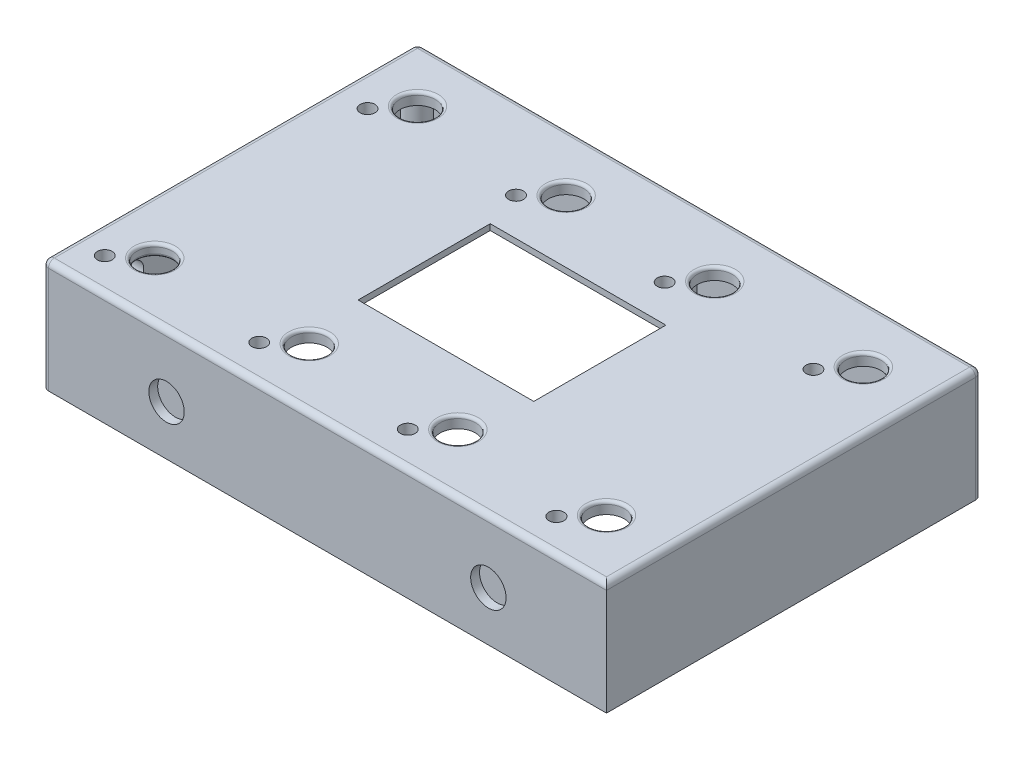
from build123d import *

# Parameters (mm, degrees)
SKETCH11_W                      = 183
SKETCH11_H                      = 119
BOSS_EXTRUDE2_DEPTH             = 34
SHELL19_T                       = 4
BOSS_EXTRUDE4_START             = -34
BOSS_EXTRUDE4_DEPTH             = 34
F_6_32_TAPPED_HOLE1_D           = 2.7051
F_6_32_TAPPED_HOLE1_DEPTH       = 10.97
F_6_32_TAPPED_HOLE1_CSINK_D     = 4.7752
F_6_32_TAPPED_HOLE1_CSINK_ANGLE = 100
F_6_32_TAPPED_HOLE1_TIP         = 0.81269403
FILLET1_R                       = 2
SKETCH15_R                      = 6
CUT_EXTRUDE2_DEPTH              = 153
FILLET2_R                       = 1
SKETCH16_R                      = 6
SKETCH16_W                      = 59.5
SKETCH16_H                      = 44.75
CUT_EXTRUDE3_DEPTH              = 153
FILLET3_R                       = 1
FILLET4_R                       = 1
FILLET5_R                       = 1
FILLET6_R                       = 1
FILLET7_R                       = 1
FILLET8_R                       = 1
FILLET9_R                       = 1
FILLET10_R                      = 1
SKETCH19_R                      = 4
SKETCH19_W                      = 14
SKETCH19_H                      = 8.25
CUT_EXTRUDE4_DEPTH              = 153
SKETCH17_R                      = 6
CUT_EXTRUDE5_DEPTH              = 3
SKETCH22_W                      = 69.6
SKETCH22_H                      = 50.2
CUT_EXTRUDE6_DEPTH              = 2
SKETCH23_R                      = 2.5
SKETCH23_R_2                    = 2.53684151
CUT_EXTRUDE7_DEPTH              = 12


# Read off the part's stored shape, not the designer's step: Boss-Extrude4
with BuildPart() as part:
    # Sketch11 → Boss-Extrude2 (new body)
    with BuildSketch(Plane(origin=(0, 0, 0), x_dir=(1, 0, 0), z_dir=(0, 1, 0))):
        Rectangle(SKETCH11_W, SKETCH11_H)
    extrude(amount=BOSS_EXTRUDE2_DEPTH)

    # Shell19
    shell19_openings = [part.faces().sort_by_distance(p)[0] for p in [
        (0, 0, 0),
    ]]
    offset(amount=SHELL19_T, openings=shell19_openings, kind=Kind.INTERSECTION)

    # Boss-Extrude4 outline → Boss-Extrude4 (add)
    with BuildSketch(Plane(origin=(0, 0, 0), x_dir=(-1, 0, 0), z_dir=(0, -1, 0)).offset(BOSS_EXTRUDE4_START)):
        with BuildLine():
            Line((-91.5, 59.5), (-91.5, 53.791632513))
            ThreePointArc((-91.5, 53.791632513), (-86.395109023, 54.372298689), (-86.072984276, 59.5))
            Line((-86.072984276, 59.5), (-91.5, 59.5))
        make_face()
        with BuildLine():
            ThreePointArc((-86.295538716, -59.5), (-86.27586418, -54.227632818), (-91.5, -53.51584091))
            Line((-91.5, -53.51584091), (-91.5, -59.5))
            Line((-91.5, -59.5), (-86.295538716, -59.5))
        make_face()
        with BuildLine():
            Line((3.221091031, 59.5), (-3.221091031, 59.5))
            ThreePointArc((-3.221091031, 59.5), (0, 53.128381867), (3.221091031, 59.5))
        make_face()
        with BuildLine():
            ThreePointArc((2.998536591, -59.5), (0, -52.852590264), (-2.998536591, -59.5))
            Line((-2.998536591, -59.5), (2.998536591, -59.5))
        make_face()
        with BuildLine():
            Line((91.5, 59.5), (86.08073914, 59.5))
            ThreePointArc((86.08073914, 59.5), (86.399665621, 54.375666676), (91.5, 53.786518703))
            Line((91.5, 53.786518703), (91.5, 59.5))
        make_face()
        with BuildLine():
            ThreePointArc((91.5, -53.5107271), (86.280573114, -54.231139178), (86.30329358, -59.5))
            Line((86.30329358, -59.5), (91.5, -59.5))
            Line((91.5, -59.5), (91.5, -53.5107271))
        make_face()
    extrude(amount=BOSS_EXTRUDE4_DEPTH)

    # #6-32 Tapped Hole1
    with Locations(Plane(origin=(0, 0, 0), x_dir=(-1, 0, 0), z_dir=(0, -1, 0))):
        with Locations((-89.294075307, 57.128381867), (-89.294075307, -56.852590264), (0, -56.852590264), (0, 57.128381867), (89.301830171, 57.128381867), (89.301830171, -56.852590264)):
            CounterSinkHole(F_6_32_TAPPED_HOLE1_D / 2, F_6_32_TAPPED_HOLE1_CSINK_D / 2, depth=F_6_32_TAPPED_HOLE1_DEPTH, counter_sink_angle=F_6_32_TAPPED_HOLE1_CSINK_ANGLE)
            with Locations((0, 0, -(F_6_32_TAPPED_HOLE1_DEPTH + F_6_32_TAPPED_HOLE1_TIP / 2))):  # 118° drill point
                Cone(0, F_6_32_TAPPED_HOLE1_D / 2, F_6_32_TAPPED_HOLE1_TIP, mode=Mode.SUBTRACT)

    # Fillet1
    fillet1_edges = [part.edges().sort_by_distance(p)[0] for p in [
        (-95.5, 38, 0),
        (0, 38, 63.5),
        (95.5, 38, 0),
        (86.295538716, 17, 59.5),
        (-95.5, 19, 63.5),
        (-95.5, 19, -63.5),
        (95.5, 19, -63.5),
        (0, 38, -63.5),
    ]]
    fillet(fillet1_edges, radius=FILLET1_R)

    # Sketch15 → Cut-Extrude2 (cut)
    with BuildSketch(Plane(origin=(0, 0, 0), x_dir=(1, 0, 0), z_dir=(0, 1, 0))):
        with Locations(Location((-76.5, 44.5, 0), (0, 0, 270))):
            Circle(SKETCH15_R)
    extrude(amount=CUT_EXTRUDE2_DEPTH, mode=Mode.SUBTRACT)

    # Fillet2
    fillet2_edges = [part.edges().sort_by_distance(p)[0] for p in [
        (-76.5, 38, -50.5),
    ]]
    fillet(fillet2_edges, radius=FILLET2_R)

    # Sketch16 → Cut-Extrude3 (cut)
    with BuildSketch(Plane(origin=(0, 38, 0), x_dir=(1, 0, 0), z_dir=(0, 1, 0))):
        with Locations(Location((75.5, 43.5, 0), (0, 0, 270))):
            Circle(SKETCH16_R)
        with Locations(Location((-25.166666667, 43.5, 0), (0, 0, 270))):
            Circle(SKETCH16_R)
        with Locations(Location((25.163333333, 43.5, 0), (0, 0, 270))):
            Circle(SKETCH16_R)
        with Locations(Location((-76.5, -44.5, 0), (0, 0, 270))):
            Circle(SKETCH16_R)
        with Locations(Location((75.5, -43.5, 0), (0, 0, 270))):
            Circle(SKETCH16_R)
        with Locations(Location((25.163333333, -43.5, 0), (0, 0, 270))):
            Circle(SKETCH16_R)
        with Locations(Location((-25.166666667, -43.5, 0), (0, 0, 270))):
            Circle(SKETCH16_R)
        Rectangle(SKETCH16_W, SKETCH16_H)
    extrude(amount=-CUT_EXTRUDE3_DEPTH, mode=Mode.SUBTRACT)

    # Fillet3
    fillet3_edges = [part.edges().sort_by_distance(p)[0] for p in [
        (-25.166666667, 38, -49.5),
    ]]
    fillet(fillet3_edges, radius=FILLET3_R)

    # Fillet4
    fillet4_edges = [part.edges().sort_by_distance(p)[0] for p in [
        (25.163333333, 38, -49.5),
    ]]
    fillet(fillet4_edges, radius=FILLET4_R)

    # Fillet5
    fillet5_edges = [part.edges().sort_by_distance(p)[0] for p in [
        (75.5, 38, -49.5),
    ]]
    fillet(fillet5_edges, radius=FILLET5_R)

    # Fillet6
    fillet6_edges = [part.edges().sort_by_distance(p)[0] for p in [
        (-76.5, 34, 38.5),
    ]]
    fillet(fillet6_edges, radius=FILLET6_R)

    # Fillet7
    fillet7_edges = [part.edges().sort_by_distance(p)[0] for p in [
        (-76.5, 38, 38.5),
    ]]
    fillet(fillet7_edges, radius=FILLET7_R)

    # Fillet8
    fillet8_edges = [part.edges().sort_by_distance(p)[0] for p in [
        (-25.166666667, 38, 37.5),
    ]]
    fillet(fillet8_edges, radius=FILLET8_R)

    # Fillet9
    fillet9_edges = [part.edges().sort_by_distance(p)[0] for p in [
        (25.163333333, 38, 37.5),
    ]]
    fillet(fillet9_edges, radius=FILLET9_R)

    # Fillet10
    fillet10_edges = [part.edges().sort_by_distance(p)[0] for p in [
        (75.5, 38, 37.5),
    ]]
    fillet(fillet10_edges, radius=FILLET10_R)

    # Sketch19 → Cut-Extrude4 (cut)
    with BuildSketch(Plane(origin=(0, 0, 0), x_dir=(0, 0, -1), z_dir=(1, 0, 0))):
        with Locations((-37.235373994, 21.795565076)):
            Circle(SKETCH19_R)
        with Locations((27.844297641, 21.795565076)):
            Circle(SKETCH19_R)
        with Locations((12.267115017, 21.795565076)):
            Rectangle(SKETCH19_W, SKETCH19_H)
    extrude(amount=-CUT_EXTRUDE4_DEPTH, mode=Mode.SUBTRACT)

    # Sketch17 → Cut-Extrude5 (cut)
    with BuildSketch(Plane.XY.offset(63.5)):
        with Locations((-53.5, 16.823905987)):
            Circle(SKETCH17_R)
        with Locations((55.5, 16.823905987)):
            Circle(SKETCH17_R)
    extrude(amount=-CUT_EXTRUDE5_DEPTH, mode=Mode.SUBTRACT)

    # Sketch22 → Cut-Extrude6 (cut)
    with BuildSketch(Plane(origin=(0, 34, 0), x_dir=(-1, 0, 0), z_dir=(0, -1, 0))):
        with Locations((2.45, 0.375)):
            Rectangle(SKETCH22_W, SKETCH22_H)
    extrude(amount=-CUT_EXTRUDE6_DEPTH, mode=Mode.SUBTRACT)

    # Sketch23 → Cut-Extrude7 (cut)
    with BuildSketch(Plane(origin=(0, 34, 0), x_dir=(-1, 0, 0), z_dir=(0, -1, 0))):
        with Locations(Location((85.649384472, -52.264583941, 0), (0, 0, 341.346464008))):
            Circle(SKETCH23_R)
        with Locations(Location((34.055496103, -51.56155762, 0), (0, 0, 90))):
            Circle(SKETCH23_R)
        with Locations(Location((-16.565382545, -51.871095642, 0), (0, 0, 90))):
            Circle(SKETCH23_R)
        with Locations(Location((-67.313670084, -52.274052798, 0), (0, 0, 90))):
            Circle(SKETCH23_R_2)
        with Locations(Location((84.282563307, 35.365904075, 0), (0, 0, 90))):
            Circle(SKETCH23_R)
        with Locations(Location((33.727380609, 35.090827818, 0), (0, 0, 90))):
            Circle(SKETCH23_R)
        with Locations(Location((-16.931610068, 34.768520625, 0), (0, 0, 90))):
            Circle(SKETCH23_R)
        with Locations(Location((-67.700854063, 34.380059065, 0), (0, 0, 90))):
            Circle(SKETCH23_R)
    extrude(amount=-CUT_EXTRUDE7_DEPTH, mode=Mode.SUBTRACT)


solid = part.part
